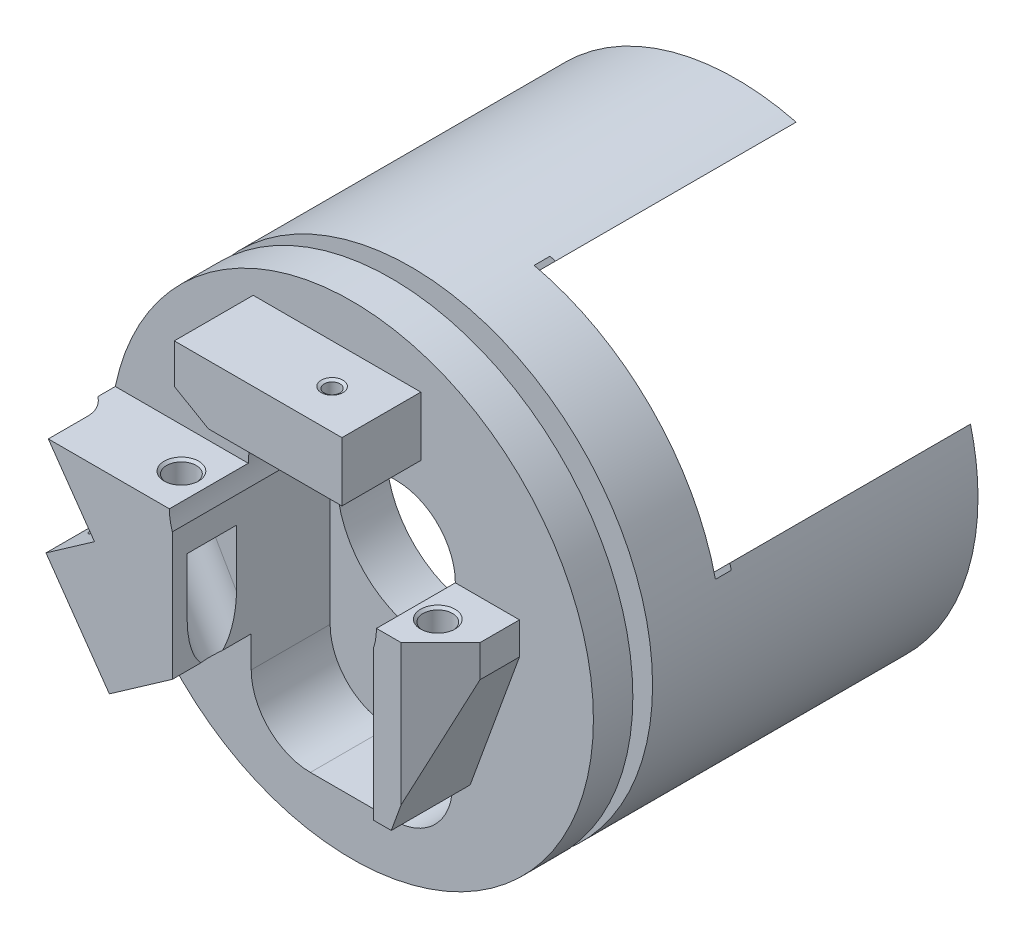
from build123d import *

# Parameters (mm, degrees)
CUT_EXTRUDE_7_DEPTH        = 16
CUT_EXTRUDE_START          = -25.5
CUT_EXTRUDE_3_OUTLINE_R    = 9.5
CUT_EXTRUDE_3_DEPTH        = 25.5
CUT_EXTRUDE_4_DEPTH        = 8
SKETCH_18_R                = 1.25
CUT_EXTRUDE_10_DEPTH       = 5
HOLE_WIZARD_M31_AT_2_COUNT = 2
HOLE_WIZARD_M31_AT_2_PITCH = 26
CHAMFER_1_SIZE             = 4
SKETCH_20_R                = 1.8
CUT_EXTRUDE_1_DEPTH        = 43.725870383
CUT_EXTRUDE_12_DEPTH       = 15
CUT_EXTRUDE_13_DEPTH       = 13
CUT_EXTRUDE_START_2        = -11.2
CUT_EXTRUDE_14_DEPTH       = 16
CUT_EXTRUDE_15_DEPTH       = 59.390924036
CUT_EXTRUDE_15_DEPTH_BACK  = 59.390924036
SKETCH_30_W                = 26
SKETCH_30_H                = 1.6


# Read off the part's stored shape, not the designer's step: Вырез-Вытянуть3
with BuildPart() as part:
    # Эскиз2 → Повернуть2 (revolve)
    with BuildSketch(Plane(origin=(0, 0, 0), x_dir=(0, 0, -1), z_dir=(1, 0, 0)), mode=Mode.PRIVATE) as revolve_2_sk:
        Polygon((-47, 9.5), (-22, 9.5), (-22, 21), (-14, 21), (-14, 20), (0, 20), (0, 24.5), (-33, 24.5), (-33, 21.5), (-35, 21.5), (-35, 24.5), (-47, 24.5), align=None)
    revolve(revolve_2_sk.sketch.rotate(Axis((0, 0, 0), (0, 0, -1)), 90), axis=Axis((0, 0, 0), (0, 0, -1)))

    # Эскиз11 → Вырез-Вытянуть7 (cut)
    with BuildSketch(Plane.XY.offset(47)):
        with BuildLine():
            Line((-4.2, -19), (4.2, -19))
            ThreePointArc((4.2, -19), (8.442640687, -17.242640687), (10.2, -13))
            Line((10.2, -13), (10.2, 3.1265006))
            ThreePointArc((10.2, 3.1265006), (9.360092406, 8.51845162), (4.5, 11))
            Line((4.5, 11), (-4.5, 11))
            ThreePointArc((-4.5, 11), (-9.360092406, 8.51845162), (-10.2, 3.1265006))
            Line((-10.2, 3.1265006), (-10.2, -13))
            ThreePointArc((-10.2, -13), (-8.442640687, -17.242640687), (-4.2, -19))
        make_face()
    extrude(amount=-CUT_EXTRUDE_7_DEPTH, mode=Mode.SUBTRACT)

    # Вырез-Вытянуть3 outline → Вырез-Вытянуть3 (cut)
    with BuildSketch(Plane(origin=(0, 0, 0), x_dir=(-1, 0, 0), z_dir=(0, 0, -1)).offset(CUT_EXTRUDE_START)):
        with BuildLine():
            ThreePointArc((6.060829661, -23.738499191), (17.324116139, -17.324116139), (23.738499191, -6.060829661))
            Line((23.738499191, -6.060829661), (-6.060829661, 23.738499191))
            ThreePointArc((-6.060829661, 23.738499191), (-17.324116139, 17.324116139), (-23.738499191, 6.060829661))
            Line((-23.738499191, 6.060829661), (6.060829661, -23.738499191))
        make_face()
        Circle(CUT_EXTRUDE_3_OUTLINE_R, mode=Mode.SUBTRACT)
    extrude(amount=CUT_EXTRUDE_3_DEPTH, mode=Mode.SUBTRACT)

    # Эскиз5 → Вырез-Вытянуть4 (cut)
    with BuildSketch(Plane.XY.offset(47)):
        with BuildLine():
            Line((17, 5), (17, 1.737387097))
            Line((17, 1.737387097), (12, -12))
            Line((12, -12), (10.2, -12))
            Line((10.2, -12), (10.2, -13))
            ThreePointArc((10.2, -13), (8.442640687, -17.242640687), (4.2, -19))
            Line((4.2, -19), (-4.2, -19))
            ThreePointArc((-4.2, -19), (-8.442640687, -17.242640687), (-10.2, -13))
            Line((-10.2, -13), (-10.2, -9.827820985))
            Line((-10.2, -9.827820985), (-16.587454885, -14.300365046))
            Line((-16.587454885, -14.300365046), (-24.273530206, -3.323511896))
            ThreePointArc((-24.273530206, -3.323511896), (1.66560949, -24.443316981), (24.5, 0))
            ThreePointArc((24.5, 0), (2.513258562, 24.370751556), (-23.98436991, 5))
            Line((-23.98436991, 5), (-10.5, 5))
            ThreePointArc((-10.5, 5), (-8.742640687, 9.242640687), (-4.5, 11))
            Line((-4.5, 11), (4.5, 11))
            ThreePointArc((4.5, 11), (8.742640687, 9.242640687), (10.5, 5))
            Line((10.5, 5), (17, 5))
        make_face()
        Polygon((-10, 20), (7, 20), (7, 14), (-6.535898385, 14), (-10, 16), align=None, mode=Mode.SUBTRACT)
    extrude(amount=-CUT_EXTRUDE_4_DEPTH, mode=Mode.SUBTRACT)

    # Эскиз18 → Вырез-Вытянуть10 (cut)
    with BuildSketch(Plane(origin=(0, 5, 0), x_dir=(1, 0, 0), z_dir=(0, 1, 0))):
        with Locations(Location((-13.2, -43.08, 0), (0, 0, 180))):
            Circle(SKETCH_18_R)
        with Locations(Location((12.8, -43.08, 0), (0, 0, 180))):
            Circle(SKETCH_18_R)
    extrude(amount=-CUT_EXTRUDE_10_DEPTH, mode=Mode.SUBTRACT)

    # Эскиз24 → Отверстие обработанное метчиком M31 (revolve, cut)
    with BuildSketch(Plane(origin=(-13.2, 5, 43.08), x_dir=(0, 0, 1), z_dir=(1, 0, 0))):
        Polygon((0, 0), (0, 9.251075774), (1.25, 8.5), (1.25, 6), (1.5, 6), (1.5, 0.25), (1.75, 0), align=None)
    hole_wizard_m31 = revolve(axis=Axis((-13.2, 11.35, 43.08), (0, -1, 0)), mode=Mode.SUBTRACT)

    # Отверстие обработанное метчиком M31 at 2: Отверстие обработанное метчиком M31 ×2
    with Locations(*[(i * HOLE_WIZARD_M31_AT_2_PITCH, 0, 0) for i in range(1, HOLE_WIZARD_M31_AT_2_COUNT)]):
        add(hole_wizard_m31, mode=Mode.SUBTRACT)

    # Фаска1
    chamfer_1_edges = [part.edges().sort_by_distance(p)[0] for p in [
        (17, 3.368693549, 47),
    ]]
    chamfer(chamfer_1_edges, length=CHAMFER_1_SIZE)

    # Эскиз20 → для отвертки_1 (cut, through all)
    with BuildSketch(Plane(origin=(0, 0, 22), x_dir=(-1, 0, 0), z_dir=(0, 0, -1))):
        with Locations((8.6, 12.7)):
            Circle(SKETCH_20_R)
    extrude(amount=-CUT_EXTRUDE_1_DEPTH, mode=Mode.SUBTRACT)

    # Эскиз21 → Отверстие обработанное метчиком M21 (revolve, cut)
    with BuildSketch(Plane(origin=(2, 20, 43), x_dir=(0, 0, 1), z_dir=(1, 0, 0))):
        Polygon((0, 0), (0, 6), (1.1, 6), (0.8, 5.826794919), (0.8, 0.173205081), (1.1, 0), align=None)
    revolve(axis=Axis((2, 26.35, 43), (0, -1, 0)), mode=Mode.SUBTRACT)

    # Эскиз23 → Вырез-Вытянуть12 (cut)
    with BuildSketch(Plane(origin=(4.75, -8.227241336, 0), x_dir=(0, 0, -1), z_dir=(-0.499999999999998, 0.8660254037844398, 0))):
        with BuildLine():
            Line((-40.5, 11.5), (-40.5, 4.634817269))
            Line((-40.5, 4.634817269), (-45.5, 4.634817269))
            Line((-45.5, 4.634817269), (-45.5, 11.5))
            ThreePointArc((-45.5, 11.5), (-43, 14), (-40.5, 11.5))
        make_face()
    extrude(amount=CUT_EXTRUDE_12_DEPTH, mode=Mode.SUBTRACT)

    # Эскиз26 → Вырез-Вытянуть13 (cut)
    with BuildSketch(Plane(origin=(-3.249191362, -8.927079897, 0), x_dir=(0, 0, 1), z_dir=(0.3420201433256694, 0.9396926207859083, 0))):
        with BuildLine():
            Line((45.5, 10.5), (45.5, 4.710471755))
            Line((45.5, 4.710471755), (40.5, 4.710471755))
            Line((40.5, 4.710471755), (40.5, 10.5))
            ThreePointArc((40.5, 10.5), (43, 13), (45.5, 10.5))
        make_face()
    extrude(amount=CUT_EXTRUDE_13_DEPTH, mode=Mode.SUBTRACT)

    # Эскиз27 → Вырез-Вытянуть14 (cut)
    with BuildSketch(Plane(origin=(1.26186816, -1.802134497, 0), x_dir=(0.8191520442889928, 0.5735764363510447, 0), z_dir=(0.5735764363510447, -0.8191520442889928, 0)).offset(CUT_EXTRUDE_START_2)):
        with BuildLine():
            Line((-18.79, 40), (-27.979598057, 40))
            Line((-27.979598057, 40), (-27.979598057, 48.487247608))
            Line((-27.979598057, 48.487247608), (-15.79, 48.487247608))
            Line((-15.79, 48.487247608), (-15.79, 43))
            ThreePointArc((-15.79, 43), (-16.668679656, 40.878679656), (-18.79, 40))
        make_face()
    extrude(amount=-CUT_EXTRUDE_14_DEPTH, mode=Mode.SUBTRACT)

    # Эскиз28 → Отверстие обработанное метчиком #2-561 (revolve, cut)
    with BuildSketch(Plane(origin=(-20.963630861, -3.691921059, 43), x_dir=(-0.8191520442889927, -0.5735764363510447, 0), z_dir=(0, 0, 1))):
        Polygon((0, 0), (0, 11.2), (1.397, 11.2), (0.889, 10.844294571), (0.889, 0.355705429), (1.397, 0), align=None)
    revolve(axis=Axis((-24.605841232, 1.509694423, 43), (0.5735764363510447, -0.8191520442889927, 0)), mode=Mode.SUBTRACT)

    # Эскиз30 → Вырез-Вытянуть15 (cut, two sides: drawn at the far end of the back side and taken through both)
    with BuildSketch(Plane(origin=(0, 0, 0), x_dir=(-0.7071067811865464, 0.7071067811865488, 0), z_dir=(0.7071067811865488, 0.7071067811865464, 0)).offset(-CUT_EXTRUDE_15_DEPTH_BACK)):
        with Locations((0, 25.2)):
            Rectangle(SKETCH_30_W, SKETCH_30_H)
    extrude(amount=CUT_EXTRUDE_15_DEPTH + CUT_EXTRUDE_15_DEPTH_BACK, mode=Mode.SUBTRACT)


solid = part.part
